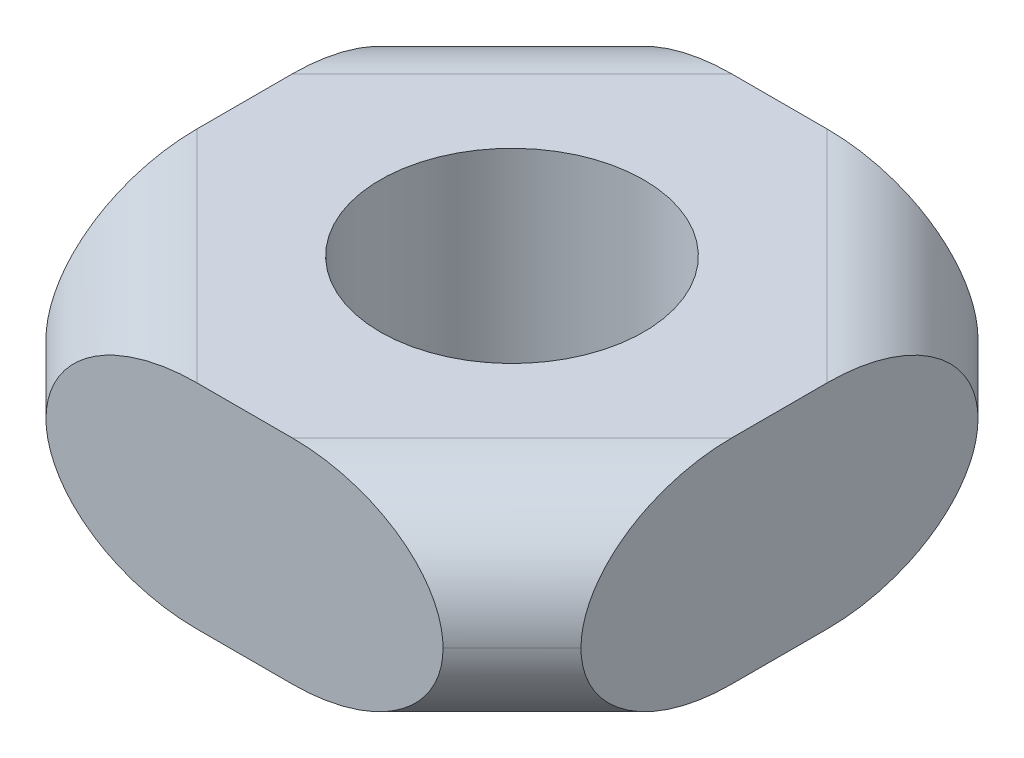
from build123d import *

# Parameters (mm, degrees)
EXTRUDE_1_DEPTH        = 5.5
FILLET_1_R             = 2.75
HOLE_WIZARD_M8_1_D     = 6.8
HOLE_WIZARD_M8_1_DEPTH = 19.75
HOLE_WIZARD_M8_1_TIP   = 2.042926105


with BuildPart() as part:
    # 草图1 → 凸台-拉伸1 (new body)
    with BuildSketch(Plane(origin=(0, 0, 0), x_dir=(1, 0, 0), z_dir=(0, 1, 0))):
        Polygon((0, 0), (10.24163056, 0), (12.02081528, 1.77918472), (12.02081528, 12.02081528), (10.24163056, 13.8), (0, 13.8), (-1.77918472, 12.02081528), (-1.77918472, 1.77918472), align=None)
    extrude(amount=EXTRUDE_1_DEPTH)

    # 圆角1
    fillet_1_edges = [part.edges().sort_by_distance(p)[0] for p in [
        (-0.88959236, 0, -12.91040764),
        (-0.88959236, 5.5, -12.91040764),
        (11.13122292, 0, -12.91040764),
        (11.13122292, 5.5, -12.91040764),
        (11.13122292, 0, -0.88959236),
        (11.13122292, 5.5, -0.88959236),
        (-0.88959236, 0, -0.88959236),
        (-0.88959236, 5.5, -0.88959236),
    ]]
    fillet(fillet_1_edges, radius=FILLET_1_R - 0.0001)  # a hair under: the kernel refuses the full size

    # M8 螺纹孔1
    with Locations(Plane(origin=(5.12081528, 5.5, -6.9), x_dir=(0, 0, 1), z_dir=(0, 1, 0))):
        with Locations((0, 0)):
            Hole(HOLE_WIZARD_M8_1_D / 2, depth=HOLE_WIZARD_M8_1_DEPTH)
            with Locations((0, 0, -(HOLE_WIZARD_M8_1_DEPTH + HOLE_WIZARD_M8_1_TIP / 2))):  # 118° drill point
                Cone(0, HOLE_WIZARD_M8_1_D / 2, HOLE_WIZARD_M8_1_TIP, mode=Mode.SUBTRACT)


solid = part.part
